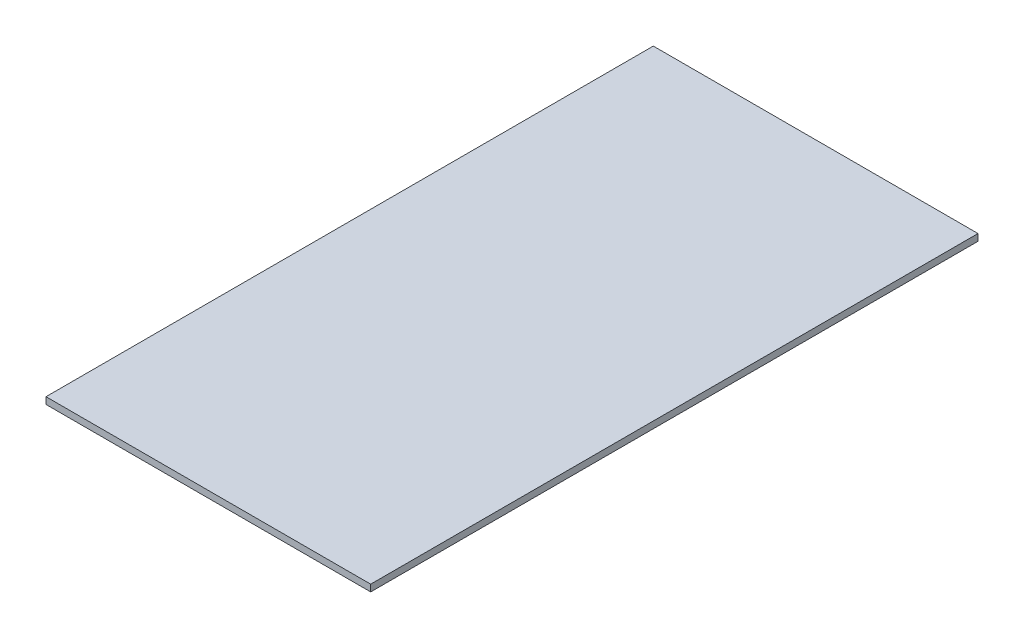
from build123d import *

# Parameters (mm, degrees)
SKETCH1_W           = 96.233553117
SKETCH1_H           = 180
BOSS_EXTRUDE1_DEPTH = 2


with BuildPart() as part:
    # Sketch1 → Boss-Extrude1 (new body)
    with BuildSketch(Plane(origin=(0, 0, 0), x_dir=(1, 0, 0), z_dir=(0, 1, 0))):
        with Locations((-5.570948508, -15.946250866)):
            Rectangle(SKETCH1_W, SKETCH1_H)
    extrude(amount=BOSS_EXTRUDE1_DEPTH)


solid = part.part
